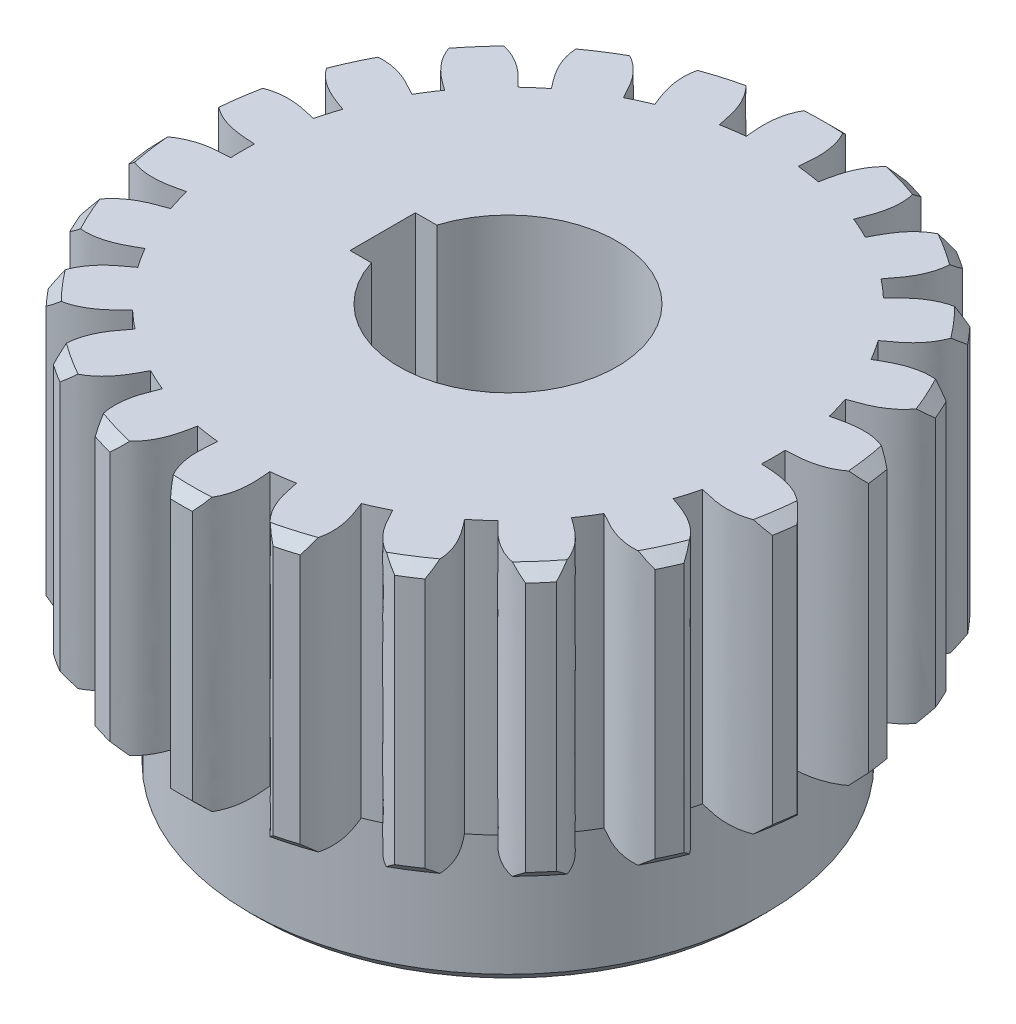
from build123d import *

# Parameters (mm, degrees)
CUT_EXTRUDE_1_REACH      = 115.248
SKETCH_2_W               = 12
SKETCH_2_H               = 12
CHAMFER_1_SIZE           = 2
CUT_EXTRUDE_2_REACH      = 100.489
PATTERN_CIRCULAR_1_COUNT = 22
HOLE_WIZARD_M8_1_D       = 6.8
HOLE_WIZARD_M8_1_DEPTH   = 37
HOLE_WIZARD_M8_2_REACH   = 145.028
HOLE_WIZARD_M8_2_BORE_R  = 3.4


with BuildPart() as part:
    # 草圖1 → 旋轉1 (revolve)
    with BuildSketch(Plane.XY, mode=Mode.PRIVATE) as revolve_1_sk:
        Polygon((20, 50), (60, 50), (60, 0), (47.5, 0), (47.5, -25), (20, -25), align=None)
    revolve(revolve_1_sk.sketch.rotate(Axis((0, -10.915079365, 0), (0, 1, 0)), 90), axis=Axis((0, -10.915079365, 0), (0, 1, 0)))

    # 草圖2 → 除料-伸長1 (cut, up to next)
    with BuildSketch(Plane(origin=(0, 50, 0), x_dir=(1, 0, 0), z_dir=(0, 1, 0)), mode=Mode.PRIVATE) as cut_extrude_1_sk1:
        with Locations((-17, 0)):
            Rectangle(SKETCH_2_W, SKETCH_2_H)
    cut_extrude_1_tool1 = extrude(cut_extrude_1_sk1.sketch, amount=-CUT_EXTRUDE_1_REACH, mode=Mode.PRIVATE) & part.part
    add(cut_extrude_1_tool1.solids().sort_by_distance((-17, 50, 0))[0], mode=Mode.SUBTRACT)

    # 導角1
    chamfer_1_edges = [part.edges().sort_by_distance(p)[0] for p in [
        (0, -25, 47.5),
        (0, 0, 60),
        (0, 50, 60),
    ]]
    chamfer(chamfer_1_edges, length=CHAMFER_1_SIZE)

    # 草圖7 → 除料-伸長2 (cut, up to next)
    with BuildSketch(Plane.XZ, mode=Mode.PRIVATE) as cut_extrude_2_sk1:
        with BuildLine():
            ThreePointArc((-48.701603699, 2.171703744), (-48.75, 0), (-48.701603699, -2.171703744))
            add(Edge.make_bspline(
                [(-59.641013308, -6.553589211), (-59.059284927, -5.906536714), (-57.274084768, -3.920870797), (-53.281629775, -2.384819856), (-50.099141831, -2.236733482), (-48.701603699, -2.171703744)],
                knots=[0, 0, 0, 0, 0.213285271, 0.654526945, 1, 1, 1, 1], degree=3))
            ThreePointArc((-59.641013308, -6.553589211), (-60, 0), (-59.641013308, 6.553589211))
            add(Edge.make_bspline(
                [(-59.641013308, 6.553589211), (-59.059284927, 5.906536714), (-57.274084768, 3.920870797), (-53.281629775, 2.384819856), (-50.099141831, 2.236733482), (-48.701603699, 2.171703744)],
                knots=[0, 0, 0, 0, 0.213285271, 0.654526945, 1, 1, 1, 1], degree=3))
        make_face()
    cut_extrude_2_tool1 = extrude(cut_extrude_2_sk1.sketch, amount=-CUT_EXTRUDE_2_REACH, mode=Mode.PRIVATE) & part.part
    cut_extrude_2 = cut_extrude_2_tool1.solids().sort_by_distance((-55.427877, 0, 0))[0]
    add(cut_extrude_2, mode=Mode.SUBTRACT)

    # 環狀複製排列1: 除料-伸長2 ×22 about axis
    pattern_circular_1_axis = Axis((0, 50.001, 0), (0, -1, 0))
    for i in range(1, PATTERN_CIRCULAR_1_COUNT):
        add(cut_extrude_2.rotate(pattern_circular_1_axis, i * 360 / PATTERN_CIRCULAR_1_COUNT), mode=Mode.SUBTRACT)

    # M8 螺紋孔1
    with Locations(Plane(origin=(-60, 10, 0), x_dir=(0, 0, -1), z_dir=(-1, 0, 0))):
        with Locations((0, 25)):
            Hole(HOLE_WIZARD_M8_1_D / 2, depth=HOLE_WIZARD_M8_1_DEPTH)

    # M8 螺紋孔2 bore → M8 螺紋孔2 (cut, up to next)
    with BuildSketch(Plane(origin=(0, 0, -60), x_dir=(1, 0, 0), z_dir=(0, 0, -1)), mode=Mode.PRIVATE) as hole_wizard_m8_2_sk1:
        with Locations((0, 15)):
            Circle(HOLE_WIZARD_M8_2_BORE_R)
    hole_wizard_m8_2_tool1 = extrude(hole_wizard_m8_2_sk1.sketch, amount=-HOLE_WIZARD_M8_2_REACH, mode=Mode.PRIVATE) & part.part
    add(hole_wizard_m8_2_tool1.solids().sort_by_distance((0, -15, -60))[0], mode=Mode.SUBTRACT)


solid = part.part
